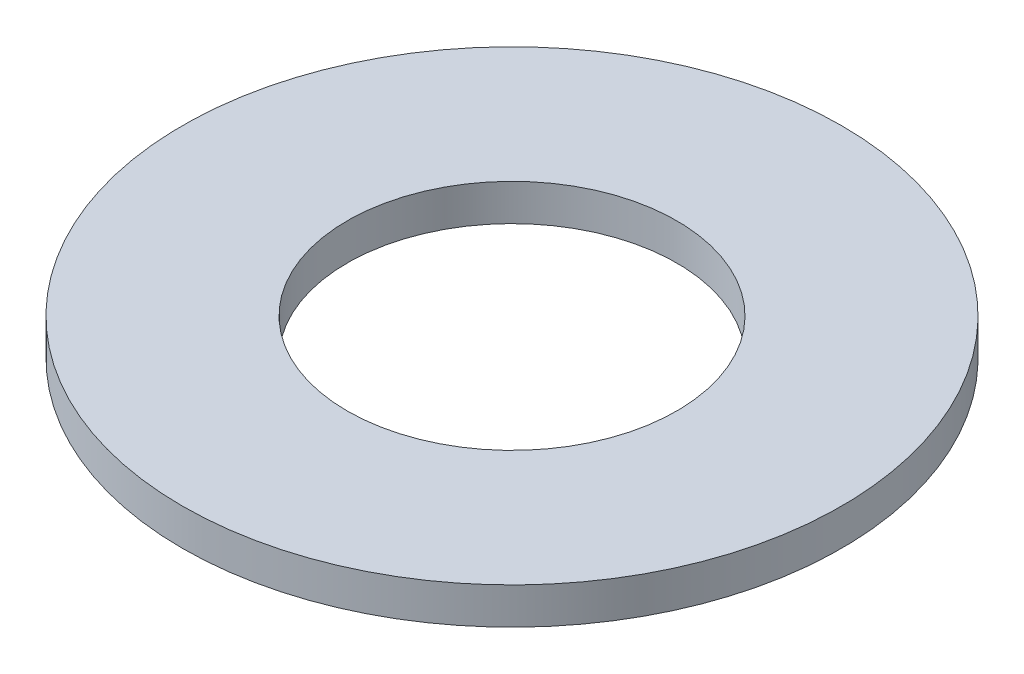
from build123d import *

# Parameters (mm, degrees)
SKETCH1_R           = 45
BOSS_EXTRUDE1_DEPTH = 5
SKETCH2_R           = 22.5
CUT_EXTRUDE1_DEPTH  = 64.835726674


with BuildPart() as part:
    # Sketch1 → Boss-Extrude1 (new body)
    with BuildSketch(Plane(origin=(0, 0, 0), x_dir=(1, 0, 0), z_dir=(0, 1, 0))):
        Circle(SKETCH1_R)
    extrude(amount=BOSS_EXTRUDE1_DEPTH)

    # Sketch2 → Cut-Extrude1 (cut, through all)
    with BuildSketch(Plane(origin=(0, 0, 0), x_dir=(1, 0, 0), z_dir=(0, 1, 0))):
        Circle(SKETCH2_R)
    extrude(amount=CUT_EXTRUDE1_DEPTH, mode=Mode.SUBTRACT)


solid = part.part
